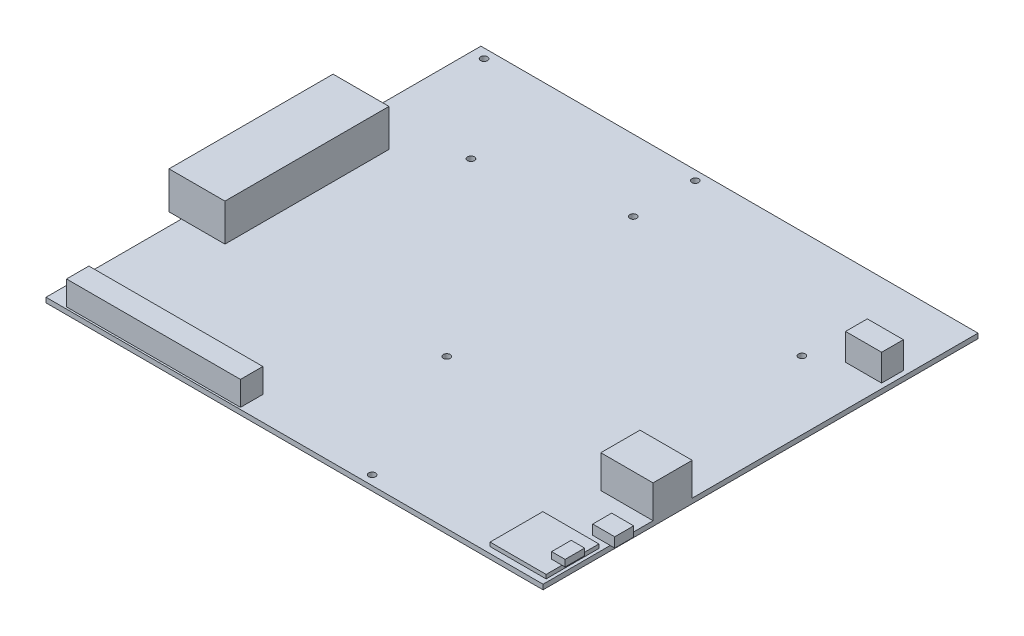
from build123d import *

# Parameters (mm, degrees)
SKETCH1_W               = 203.2
SKETCH1_H               = 177.8
BOSS_EXTRUDE1_DEPTH     = 2
SKETCH3_W               = 21.35
SKETCH3_H               = 16
BOSS_EXTRUDE2_DEPTH     = 13.4
CUT_EXTRUDE1_DEPTH      = 136.666244881
CUT_EXTRUDE1_DEPTH_BACK = 136.666244881
SKETCH2_R               = 1.397
SKETCH4_W               = 22.86
SKETCH4_H               = 67.056
BOSS_EXTRUDE3_DEPTH     = 15.24
SKETCH5_W               = 14.75
SKETCH5_H               = 8.9
BOSS_EXTRUDE4_DEPTH     = 10.922
SKETCH7_W               = 9
SKETCH7_H               = 7.75
BOSS_EXTRUDE5_DEPTH     = 4
SKETCH8_W               = 22.9
SKETCH8_H               = 21.57
BOSS_EXTRUDE6_DEPTH     = 1.6
SKETCH9_W               = 5.5
SKETCH9_H               = 8
BOSS_EXTRUDE7_DEPTH     = 2.7
SKETCH10_W              = 71.12
SKETCH10_H              = 9.144
BOSS_EXTRUDE8_DEPTH     = 9.906


with BuildPart() as part:
    # Sketch1 → Boss-Extrude1 (new body)
    with BuildSketch(Plane(origin=(0, 0, 0), x_dir=(1, 0, 0), z_dir=(0, 1, 0))):
        Rectangle(SKETCH1_W, SKETCH1_H)
    extrude(amount=BOSS_EXTRUDE1_DEPTH)

    # Sketch3 → Boss-Extrude2 (add)
    with BuildSketch(Plane(origin=(0, 2, 0), x_dir=(1, 0, 0), z_dir=(0, 1, 0))):
        with Locations((90.925, -35.94)):
            Rectangle(SKETCH3_W, SKETCH3_H)
    extrude(amount=BOSS_EXTRUDE2_DEPTH)

    # Sketch2 → Cut-Extrude1 (cut, two sides: drawn at the far end of the back side and taken through both)
    with BuildSketch(Plane(origin=(0, 2, 0), x_dir=(1, 0, 0), z_dir=(0, 1, 0)).offset(-CUT_EXTRUDE1_DEPTH_BACK)):
        with Locations((-96.52, 85.09)):
            Circle(SKETCH2_R)
        with Locations((-10.16, 85.09)):
            Circle(SKETCH2_R)
        with Locations((-10.16, 59.69)):
            Circle(SKETCH2_R)
        with Locations((73.66, 44.831)):
            Circle(SKETCH2_R)
        with Locations((-63.754, 46.99)):
            Circle(SKETCH2_R)
        with Locations((1.27, -27.94)):
            Circle(SKETCH2_R)
        with Locations((-96.52, -79.756)):
            Circle(SKETCH2_R)
        with Locations((27.94, -85.09)):
            Circle(SKETCH2_R)
        with Locations((-88.9, -30.48)):
            Circle(SKETCH2_R)
        with Locations((-88.9, 30.48)):
            Circle(SKETCH2_R)
    extrude(amount=CUT_EXTRUDE1_DEPTH + CUT_EXTRUDE1_DEPTH_BACK, mode=Mode.SUBTRACT)

    # Sketch4 → Boss-Extrude3 (add)
    with BuildSketch(Plane(origin=(0, 2, 0), x_dir=(1, 0, 0), z_dir=(0, 1, 0))):
        with Locations((-95.25, 0)):
            Rectangle(SKETCH4_W, SKETCH4_H)
    extrude(amount=BOSS_EXTRUDE3_DEPTH)

    # Sketch5 → Boss-Extrude4 (add)
    with BuildSketch(Plane(origin=(0, 2, 0), x_dir=(1, 0, 0), z_dir=(0, 1, 0))):
        with Locations((92.225, 55.95)):
            Rectangle(SKETCH5_W, SKETCH5_H)
    extrude(amount=BOSS_EXTRUDE4_DEPTH)

    # Sketch7 → Boss-Extrude5 (add)
    with BuildSketch(Plane(origin=(0, 2, 0), x_dir=(1, 0, 0), z_dir=(0, 1, 0))):
        with Locations((98.95, -57.575)):
            Rectangle(SKETCH7_W, SKETCH7_H)
    extrude(amount=BOSS_EXTRUDE5_DEPTH)

    # Sketch8 → Boss-Extrude6 (add)
    with BuildSketch(Plane(origin=(0, 2, 0), x_dir=(1, 0, 0), z_dir=(0, 1, 0))):
        with Locations((88.9, -75.615)):
            Rectangle(SKETCH8_W, SKETCH8_H)
    extrude(amount=BOSS_EXTRUDE6_DEPTH)

    # Sketch9 → Boss-Extrude7 (add)
    with BuildSketch(Plane(origin=(0, 3.6, 0), x_dir=(1, 0, 0), z_dir=(0, 1, 0))):
        with Locations((98.85, -75.9)):
            Rectangle(SKETCH9_W, SKETCH9_H)
    extrude(amount=BOSS_EXTRUDE7_DEPTH)

    # Sketch10 → Boss-Extrude8 (add)
    with BuildSketch(Plane(origin=(0, 2, 0), x_dir=(1, 0, 0), z_dir=(0, 1, 0))):
        with Locations((-58.42, -83.566)):
            Rectangle(SKETCH10_W, SKETCH10_H)
    extrude(amount=BOSS_EXTRUDE8_DEPTH)


solid = part.part
